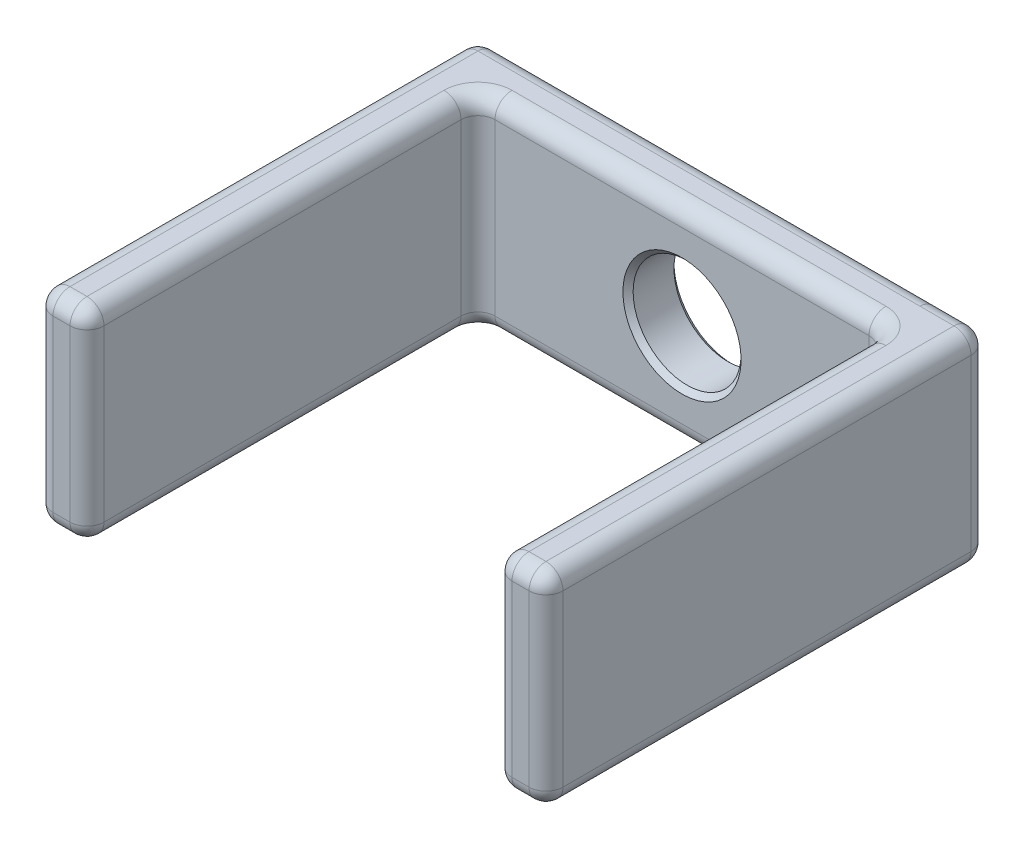
from build123d import *

# Parameters (mm, degrees)
SKETCH1_W           = 24
SKETCH1_H           = 12
SKETCH1_R           = 3.175
BOSS_EXTRUDE1_DEPTH = 3
SKETCH3_W           = 3
SKETCH3_H           = 12
BOSS_EXTRUDE2_DEPTH = 26
FILLET1_R           = 1
CHAMFER1_SIZE       = 0.3


# Read off the part's stored shape, not the designer's step: Mirror1
with BuildPart() as part:
    # Sketch1 → Boss-Extrude1 (new body)
    with BuildSketch(Plane.XY):
        Rectangle(SKETCH1_W, SKETCH1_H)
        Circle(SKETCH1_R, mode=Mode.SUBTRACT)
    extrude(amount=BOSS_EXTRUDE1_DEPTH)

    # Sketch3 → Boss-Extrude2 (add)
    with BuildSketch(Plane.XY):
        with Locations((-13.5, 0)):
            Rectangle(SKETCH3_W, SKETCH3_H)
    extrude(amount=BOSS_EXTRUDE2_DEPTH)

    # Fillet1
    fillet1_edges = [part.edges().sort_by_distance(p)[0] for p in [
        (-12, 0, 3),
        (0, -6, 3),
        (-15, 0, 0),
        (-15, 6, 13),
        (-15, -6, 13),
        (-12, -6, 14.5),
        (-12, 6, 14.5),
        (-15, 0, 26),
        (-13.5, -6, 26),
        (-12, 0, 26),
        (-13.5, 6, 26),
        (-1.5, -6, 0),
        (-1.5, 6, 0),
        (0, 6, 3),
    ]]
    fillet(fillet1_edges, radius=FILLET1_R)

    # Mirror1: part across plane


with BuildPart() as part_1:
    add(part.part)
    add(part.part.mirror(Plane(origin=(0, 0, 0), x_dir=(0, 0, 1), z_dir=(1, 0, 0))))

    # Chamfer1
    chamfer1_edges = [part_1.edges().sort_by_distance(p)[0] for p in [
        (-3.175, 0, 0),
        (-3.175, 0, 3),
    ]]
    chamfer(chamfer1_edges, length=CHAMFER1_SIZE)


solid = part_1.part
